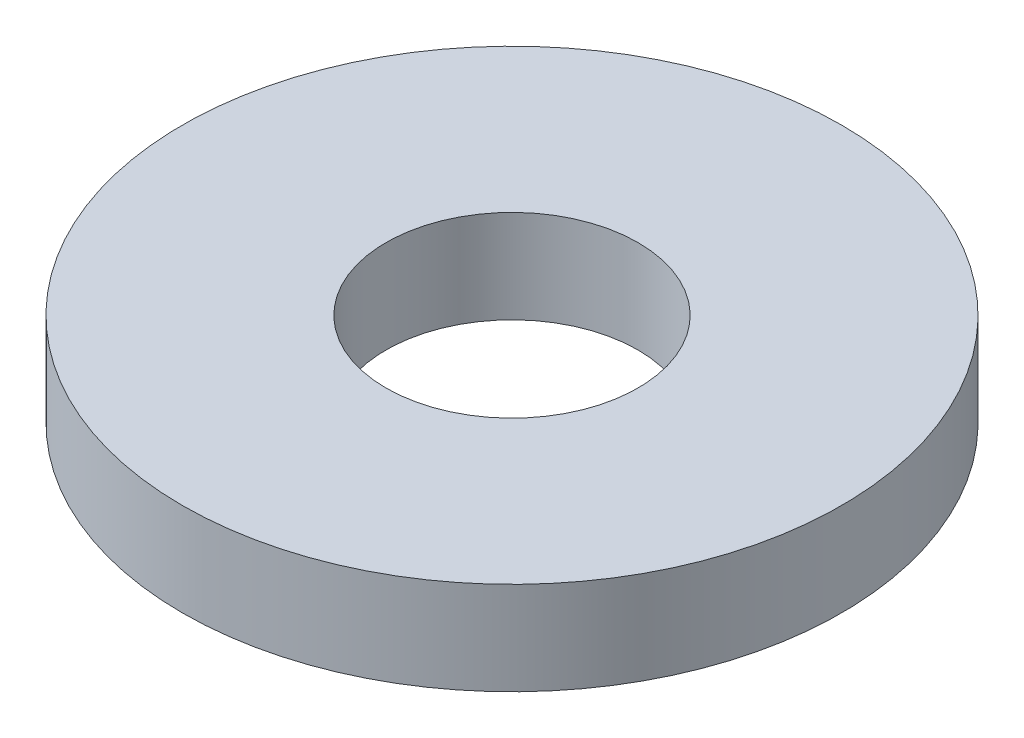
from build123d import *

# Parameters (mm, degrees)
SKETCH1_R           = 85
BOSS_EXTRUDE1_DEPTH = 24
SKETCH2_R           = 32.5
CUT_EXTRUDE1_DEPTH  = 123.580585739


with BuildPart() as part:
    # Sketch1 → Boss-Extrude1 (new body)
    with BuildSketch(Plane(origin=(0, 0, 0), x_dir=(1, 0, 0), z_dir=(0, 1, 0))):
        Circle(SKETCH1_R)
    extrude(amount=BOSS_EXTRUDE1_DEPTH)

    # Sketch2 → Cut-Extrude1 (cut, through all)
    with BuildSketch(Plane(origin=(0, 0, 0), x_dir=(1, 0, 0), z_dir=(0, 1, 0))):
        Circle(SKETCH2_R)
    extrude(amount=CUT_EXTRUDE1_DEPTH, mode=Mode.SUBTRACT)


solid = part.part
